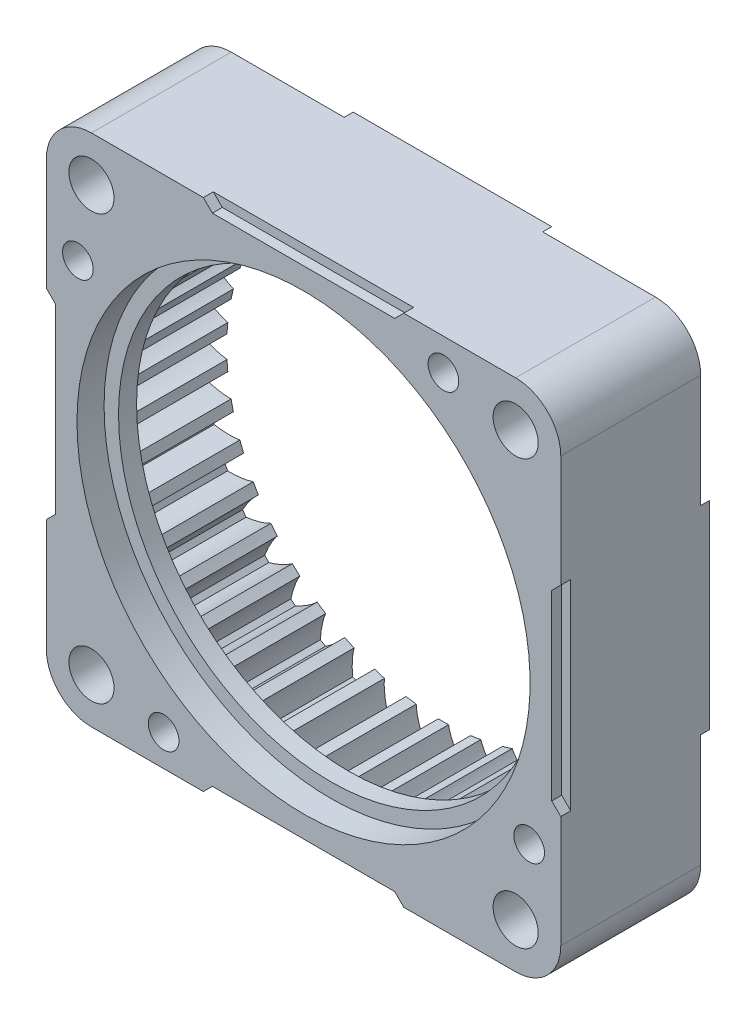
from build123d import *

# Parameters (mm, degrees)
SKETCH_1_R                           = 29.4
SKETCH_1_R_2                         = 26.7
LASHENA_DEPTH                        = 10.5
CUT_EXTRUDEA_DEPTH                   = 10.5
WWW_KYTOOL_CN_COUNT                  = 42
SKETCH_12_W                          = 77
SKETCH_12_H                          = 77
SKETCH_12_W_2                        = 57
SKETCH_12_H_2                        = 57
CUT_EXTRUDE_2_DEPTH                  = 45.373077556
EXTRUDE_7_DEPTH                      = 15.5
MIRROR_2_COPY_1_DEPTH                = 15.5
SKETCH_8_R                           = 2.5
SKETCH_8_R_2                         = 1.7
CUT_EXTRUDE_1_DEPTH                  = 44.182751318
EXTRUDE_6_DEPTH                      = 1
CHAMFER_1_SIZE                       = 0.2
CUT_EXTRUDE_2_2_DEPTH                = 1.1
PATTERN_CIRCULAR_1_COUNT             = 4
CHAMFER_1_OF_PATTERN_CIRCULAR_1_SIZE = 0.2
FILLET_1_R                           = 5


with BuildPart() as part:
    # 草图1 → LaShenA (new body)
    with BuildSketch(Plane.XY):
        with Locations(Location((0, 0, 0), (0, 0, 180))):
            Circle(SKETCH_1_R)
        with Locations(Location((0, 0, 0), (0, 0, 180))):
            Circle(SKETCH_1_R_2, mode=Mode.SUBTRACT)
    extrude(amount=LASHENA_DEPTH)

    # SketchA → Cut-ExtrudeA (add)
    with BuildSketch(Plane.XY.offset(10.5)):
        with BuildLine():
            ThreePointArc((0.56803113, 24), (0, 24.006721129), (-0.56803113, 24))
            add(Edge.make_bspline(
                [(-0.56803113, 24), (-0.583838136, 24.076457589), (-0.605571654, 24.179582895), (-0.637800373, 24.310283186), (-0.660121028, 24.395142963), (-0.68538066, 24.485330782), (-0.713742244, 24.580776004), (-0.745380903, 24.681400983), (-0.780466037, 24.787124801), (-0.81916646, 24.89786221), (-0.861648791, 25.013523989), (-0.908077807, 25.134016888), (-0.958616233, 25.259243694), (-1.013424695, 25.389103266), (-1.072661624, 25.523490578), (-1.136483177, 25.662296762), (-1.205043156, 25.805409158), (-1.278492927, 25.952711357), (-1.356981338, 26.104083254), (-1.440654641, 26.259401095), (-1.529656425, 26.418537534), (-1.624127488, 26.581361682), (-1.75959691, 26.806575573), (-1.86682545, 26.97550631), (-1.941100376, 27.088650417)],
                knots=[0, 0, 0, 0, 0.068895379, 0.092962782, 0.118768807, 0.146313455, 0.175596725, 0.206618617, 0.239379131, 0.273878268, 0.310116027, 0.348092409, 0.387807413, 0.429261039, 0.472453287, 0.517384158, 0.564053651, 0.612461767, 0.662608505, 0.714493865, 0.768117847, 0.823480452, 0.880581679, 1, 1, 1, 1], degree=3))
            ThreePointArc((-1.941100376, 27.088650417), (0, 27.158108404), (1.941100376, 27.088650417))
            add(Edge.make_bspline(
                [(0.56803113, 24), (0.583838136, 24.076457589), (0.605571654, 24.179582895), (0.637800373, 24.310283186), (0.660121028, 24.395142963), (0.68538066, 24.485330782), (0.713742244, 24.580776004), (0.745380903, 24.681400983), (0.780466037, 24.787124801), (0.81916646, 24.89786221), (0.861648791, 25.013523989), (0.908077807, 25.134016888), (0.958616233, 25.259243694), (1.013424695, 25.389103266), (1.072661624, 25.523490578), (1.136483177, 25.662296762), (1.205043156, 25.805409158), (1.278492927, 25.952711357), (1.356981338, 26.104083254), (1.440654641, 26.259401095), (1.529656425, 26.418537534), (1.624127488, 26.581361682), (1.75959691, 26.806575573), (1.86682545, 26.97550631), (1.941100376, 27.088650417)],
                knots=[0, 0, 0, 0, 0.068895379, 0.092962782, 0.118768807, 0.146313455, 0.175596725, 0.206618617, 0.239379131, 0.273878268, 0.310116027, 0.348092409, 0.387807413, 0.429261039, 0.472453287, 0.517384158, 0.564053651, 0.612461767, 0.662608505, 0.714493865, 0.768117847, 0.823480452, 0.880581679, 1, 1, 1, 1], degree=3))
        make_face()
    cut_extrudea = extrude(amount=-CUT_EXTRUDEA_DEPTH)

    # www.KYTool.cn: Cut-ExtrudeA ×42 about axis
    www_kytool_cn_axis = Axis((0, 0, -88.99), (0, 0, 1))
    for i in range(1, WWW_KYTOOL_CN_COUNT):
        add(cut_extrudea.rotate(www_kytool_cn_axis, i * 360 / WWW_KYTOOL_CN_COUNT))

    # 草图11 → 旋转1 (revolve)
    with BuildSketch(Plane(origin=(0, 0, 0), x_dir=(1, 0, 0), z_dir=(0, 1, 0))):
        Polygon((-23.5, -10.5), (-29.4, -10.5), (-29.4, -15.5), (-25.1, -15.5), (-25.1, -12.5), (-23.5, -12.5), align=None)
    revolve(axis=Axis((0, 0, 0), (0, 0, 1)))

    # 草图12 → Cut-Extrude 2 (cut, through all)
    with BuildSketch(Plane(origin=(0, 0, 0), x_dir=(-1, 0, 0), z_dir=(0, 0, -1))):
        Rectangle(SKETCH_12_W, SKETCH_12_H)
        Rectangle(SKETCH_12_W_2, SKETCH_12_H_2, mode=Mode.SUBTRACT)
    extrude(amount=-CUT_EXTRUDE_2_DEPTH, mode=Mode.SUBTRACT)

    # 草图13 → 凸台-拉伸7 (add)
    with BuildSketch(Plane(origin=(0, 0, 0), x_dir=(-1, 0, 0), z_dir=(0, 0, -1))):
        with BuildLine():
            Line((-28.5, 7.218725649), (-28.5, 28.5))
            Line((-28.5, 28.5), (-7.218725649, 28.5))
            ThreePointArc((-7.218725649, 28.5), (-20.788939367, 20.788939367), (-28.5, 7.218725649))
        make_face()
    extrude_7 = extrude(amount=-EXTRUDE_7_DEPTH)

    # 镜向1: 凸台-拉伸7 across plane
    add(extrude_7.mirror(Plane.ZX))

    # 镜向2: 凸台-拉伸7 across plane
    add(extrude_7.mirror(Plane(origin=(0, 0, 0), x_dir=(0, 0, 1), z_dir=(1, 0, 0))))

    # 镜向2 copy 1 sketch → 镜向2 copy 1 (add)
    with BuildSketch(Plane(origin=(0, 0, 0), x_dir=(1, 0, 0), z_dir=(0, 0, -1))):
        with BuildLine():
            Line((-28.5, 7.218725649), (-28.5, 28.5))
            Line((-28.5, 28.5), (-7.218725649, 28.5))
            ThreePointArc((-7.218725649, 28.5), (-20.788939367, 20.788939367), (-28.5, 7.218725649))
        make_face()
    extrude(amount=-MIRROR_2_COPY_1_DEPTH)

    # 草图8 → 切除-拉伸1 (cut, through all)
    with BuildSketch(Plane(origin=(0, 0, 0), x_dir=(-1, 0, 0), z_dir=(0, 0, -1))):
        with Locations((-23.5, 23.5)):
            Circle(SKETCH_8_R)
        with Locations((-15.5, 25)):
            Circle(SKETCH_8_R_2)
    cut_extrude_1 = extrude(amount=-CUT_EXTRUDE_1_DEPTH, mode=Mode.SUBTRACT)

    # 草图9 → 凸台-拉伸6 (add)
    with BuildSketch(Plane(origin=(0, 0, 0), x_dir=(-1, 0, 0), z_dir=(0, 0, -1))):
        Polygon((-28.5, 11), (-28.5, -11), (-27.5, -10), (-27.5, 10), align=None)
    extrude_6 = extrude(amount=EXTRUDE_6_DEPTH)

    # 倒角1
    chamfer_1_edges = [part.edges().sort_by_distance(p)[0] for p in [
        (27.5, 0, -1),
    ]]
    chamfer(chamfer_1_edges, length=CHAMFER_1_SIZE)

    # 草图10 → Cut-Extrude 2 2 (cut)
    with BuildSketch(Plane.XY.offset(15.5)):
        Polygon((28.5, 11.1), (28.5, -11.1), (27.5, -10.1), (27.5, 10.1), align=None)
    cut_extrude_2_2 = extrude(amount=-CUT_EXTRUDE_2_2_DEPTH, mode=Mode.SUBTRACT)

    # 阵列(圆周)1: 切除-拉伸1, 凸台-拉伸6, Cut-Extrude 2 2 ×4 about axis
    pattern_circular_1_axis = Axis((0, 0, 0), (0, 0, 1))
    add([cut_extrude_1.rotate(pattern_circular_1_axis, i * 360 / PATTERN_CIRCULAR_1_COUNT) for i in range(1, PATTERN_CIRCULAR_1_COUNT)], mode=Mode.SUBTRACT)
    add([extrude_6.rotate(pattern_circular_1_axis, i * 360 / PATTERN_CIRCULAR_1_COUNT) for i in range(1, PATTERN_CIRCULAR_1_COUNT)])
    add([cut_extrude_2_2.rotate(pattern_circular_1_axis, i * 360 / PATTERN_CIRCULAR_1_COUNT) for i in range(1, PATTERN_CIRCULAR_1_COUNT)], mode=Mode.SUBTRACT)

    # 倒角1 of 阵列(圆周)1
    chamfer_1_of_pattern_circular_1_edges = [part.edges().sort_by_distance(p)[0] for p in [
        (0, 27.5, -1),
        (-27.5, 0, -1),
        (0, -27.5, -1),
    ]]
    chamfer(chamfer_1_of_pattern_circular_1_edges, length=CHAMFER_1_OF_PATTERN_CIRCULAR_1_SIZE)

    # 圆角1
    fillet_1_edges = [part.edges().sort_by_distance(p)[0] for p in [
        (28.5, 28.5, 7.75),
        (28.5, -28.5, 7.75),
        (-28.5, -28.5, 7.75),
        (-28.5, 28.5, 7.75),
    ]]
    fillet(fillet_1_edges, radius=FILLET_1_R)


solid = part.part
